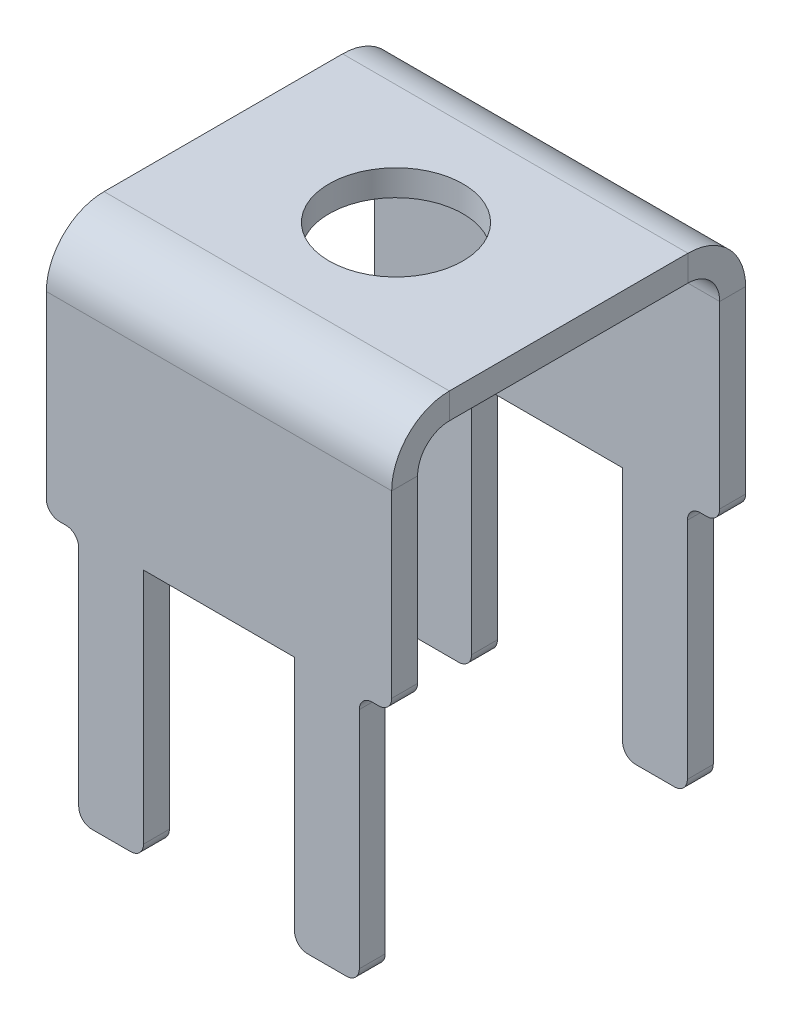
from build123d import *

# Parameters (mm, degrees)
SKETCH_1_W                         = 8
SKETCH_1_H                         = 8.2
SM_BASE_FLANGE_1_DEPTH             = 0.6
SM_EDGE_FLANGE_1_STRIP_W           = 3.8732
SM_EDGE_FLANGE_1_STRIP_H           = 0.6
SM_EDGE_FLANGE_1_STRIP_CUT_DEPTH   = 8
SM_EDGE_FLANGE_1_STRIP_2_W         = 3.8732
SM_EDGE_FLANGE_1_STRIP_2_H         = 0.6
SM_EDGE_FLANGE_1_STRIP_CUT_2_DEPTH = 8
SM_EDGE_FLANGE_1_DEPTH             = 8
SM_EDGE_FLANGE_1_BEND_DEPTH        = 8
SKETCH_10_OUTSIDE_W                = 13.26
SKETCH_10_OUTSIDE_H                = 13.46
SKETCH_10_OUTSIDE_W_2              = 1.5
SKETCH_10_OUTSIDE_H_2              = 9.508037294
CUT_EXTRUDE_1_DEPTH                = 5.8
FILLET_1_R                         = 0.3
FILLET_2_R                         = 0.3
SKETCH_11_R                        = 1.55
CUT_EXTRUDE_2_DEPTH                = 5.8


# Sheet-metal steps are written as plain solids
with BuildPart() as part:
    # Sketch 1 → 基体-法兰1 (new body)
    with BuildSketch(Plane(origin=(0, 0, 0), x_dir=(1, 0, 0), z_dir=(0, 1, 0))):
        Rectangle(SKETCH_1_W, SKETCH_1_H)
    extrude(amount=-SM_BASE_FLANGE_1_DEPTH)

    # 边线-法兰1 strip (across the edge) → 边线-法兰1 strip cut (cut)
    with BuildSketch(Plane(origin=(4, -0.6, 4.1), x_dir=(0, 0, -1), z_dir=(-1, 0, 0))):
        with Locations((-0.6, -0.3)):
            Rectangle(SM_EDGE_FLANGE_1_STRIP_W, SM_EDGE_FLANGE_1_STRIP_H)
    extrude(amount=SM_EDGE_FLANGE_1_STRIP_CUT_DEPTH, mode=Mode.SUBTRACT)

    # 边线-法兰1 strip 2 (across the edge) → 边线-法兰1 strip cut 2 (cut)
    with BuildSketch(Plane(origin=(-4, -0.6, -4.1), x_dir=(0, 0, 1), z_dir=(1, 0, 0))):
        with Locations((-0.6, -0.3)):
            Rectangle(SM_EDGE_FLANGE_1_STRIP_2_W, SM_EDGE_FLANGE_1_STRIP_2_H)
    extrude(amount=SM_EDGE_FLANGE_1_STRIP_CUT_2_DEPTH, mode=Mode.SUBTRACT)

    # 边线-法兰1 section (across the edge) → 边线-法兰1 (add)
    with BuildSketch(Plane(origin=(4, -0.6, 4.1), x_dir=(0, 0, -1), z_dir=(-1, 0, 0))):
        with BuildLine():
            Line((0, 0.7366), (0, 11))
            Line((0, 11), (0.6, 11))
            Line((0.6, 11), (0.6, 0.7366))
            ThreePointArc((0.6, 0.7366), (0.815745145, 0.215745145), (1.3366, 0))
            Line((1.3366, 0), (1.3366, -0.6))
            ThreePointArc((1.3366, -0.6), (0.391481076, -0.208518924), (0, 0.7366))
        make_face()
    extrude(amount=SM_EDGE_FLANGE_1_DEPTH)

    # 边线-法兰1 section 2 (across the edge) → 边线-法兰1 bend (add)
    with BuildSketch(Plane(origin=(-4, -0.6, -4.1), x_dir=(0, 0, 1), z_dir=(1, 0, 0))):
        with BuildLine():
            Line((0, 0.7366), (0, 11))
            Line((0, 11), (0.6, 11))
            Line((0.6, 11), (0.6, 0.7366))
            ThreePointArc((0.6, 0.7366), (0.815745145, 0.215745145), (1.3366, 0))
            Line((1.3366, 0), (1.3366, -0.6))
            ThreePointArc((1.3366, -0.6), (0.391481076, -0.208518924), (0, 0.7366))
        make_face()
    extrude(amount=SM_EDGE_FLANGE_1_BEND_DEPTH)

    # 草图10 outside → 切除-拉伸1 (cut)
    with BuildSketch(Plane.XZ.offset(11.6)):
        Rectangle(SKETCH_10_OUTSIDE_W, SKETCH_10_OUTSIDE_H)
        with Locations((-2.5, -0.421070223)):
            Rectangle(SKETCH_10_OUTSIDE_W_2, SKETCH_10_OUTSIDE_H_2, mode=Mode.SUBTRACT)
        with Locations((2.5, -0.421070223)):
            Rectangle(SKETCH_10_OUTSIDE_W_2, SKETCH_10_OUTSIDE_H_2, mode=Mode.SUBTRACT)
    extrude(amount=-CUT_EXTRUDE_1_DEPTH, mode=Mode.SUBTRACT)

    # 圆角1
    fillet_1_edges = [part.edges().sort_by_distance(p)[0] for p in [
        (-3.25, -11.6, 3.8),
        (-1.75, -11.6, 3.8),
        (3.25, -11.6, 3.8),
        (1.75, -11.6, 3.8),
        (1.75, -11.6, -3.8),
        (3.25, -11.6, -3.8),
        (-1.75, -11.6, -3.8),
        (-3.25, -11.6, -3.8),
    ]]
    fillet(fillet_1_edges, radius=FILLET_1_R)

    # 圆角2
    fillet_2_edges = [part.edges().sort_by_distance(p)[0] for p in [
        (3.25, -5.8, 3.8),
        (-3.25, -5.8, 3.8),
        (-3.25, -5.8, -3.8),
        (3.25, -5.8, -3.8),
        (-4, -5.8, 3.8),
        (-4, -5.8, -3.8),
        (4, -5.8, -3.8),
        (4, -5.8, 3.8),
    ]]
    fillet(fillet_2_edges, radius=FILLET_2_R)

    # 草图11 → 切除-拉伸2 (cut)
    with BuildSketch(Plane(origin=(0, 0, 0), x_dir=(1, 0, 0), z_dir=(0, 1, 0))):
        with Locations(Location((0, 0, 0), (0, 0, 270))):
            Circle(SKETCH_11_R)
    extrude(amount=-CUT_EXTRUDE_2_DEPTH, mode=Mode.SUBTRACT)


solid = part.part
